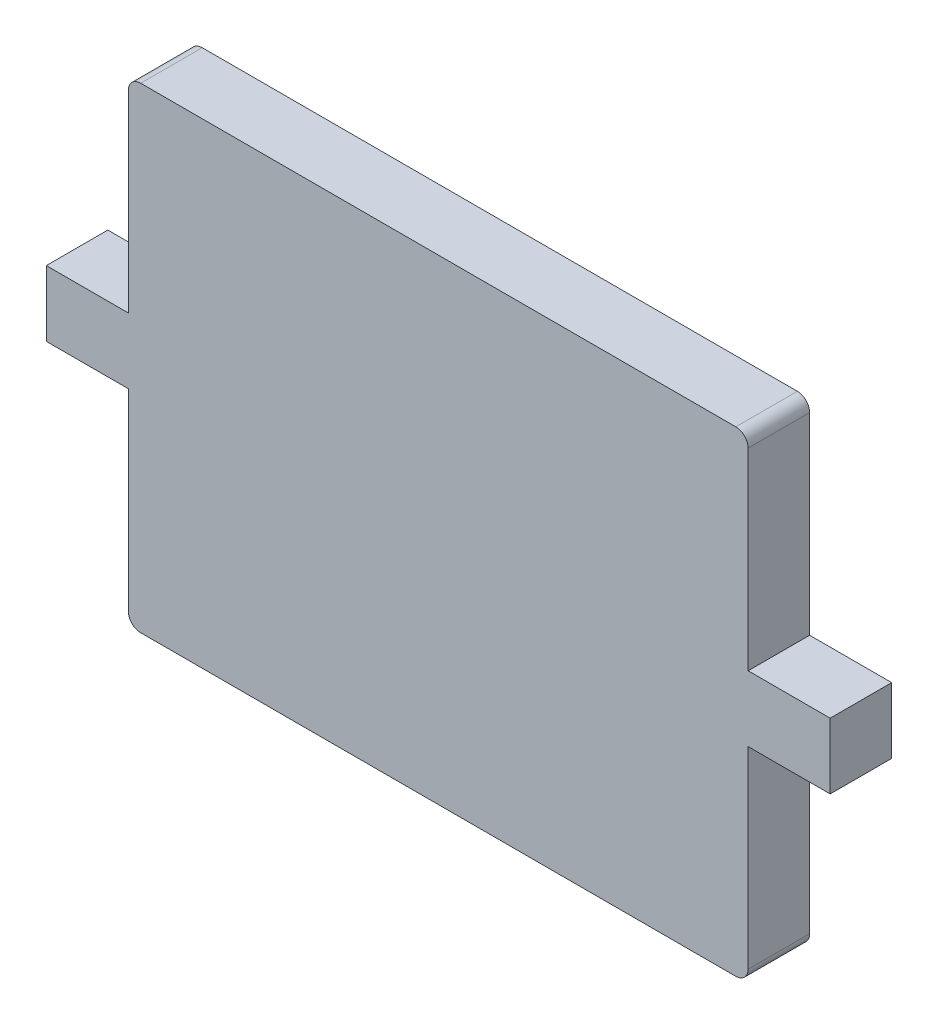
from build123d import *

# Parameters (mm, degrees)
BOSS_EXTRUDE1_DEPTH = 1.5


with BuildPart() as part:
    # Sketch1 → Boss-Extrude1 (new body)
    with BuildSketch(Plane.XY):
        with BuildLine():
            Line((10.518968464, -1.95), (10.518968464, 2.75))
            ThreePointArc((10.518968464, 2.75), (10.431100498, 2.962132034), (10.218968464, 3.05))
            Line((10.218968464, 3.05), (-4.288539585, 3.05))
            ThreePointArc((-4.288539585, 3.05), (-4.50067162, 2.962132034), (-4.588539585, 2.75))
            Line((-4.588539585, 2.75), (-4.588539585, -1.95))
            Line((-4.588539585, -1.95), (-6.588539585, -1.95))
            Line((-6.588539585, -1.95), (-6.588539585, -3.55))
            Line((-6.588539585, -3.55), (-4.588539585, -3.55))
            Line((-4.588539585, -3.55), (-4.588539585, -8.25))
            ThreePointArc((-4.588539585, -8.25), (-4.50067162, -8.462132034), (-4.288539585, -8.55))
            Line((-4.288539585, -8.55), (10.218968464, -8.55))
            ThreePointArc((10.218968464, -8.55), (10.431100498, -8.462132034), (10.518968464, -8.25))
            Line((10.518968464, -8.25), (10.518968464, -3.55))
            Line((10.518968464, -3.55), (12.518968464, -3.55))
            Line((12.518968464, -3.55), (12.518968464, -1.95))
            Line((12.518968464, -1.95), (10.518968464, -1.95))
        make_face()
    extrude(amount=BOSS_EXTRUDE1_DEPTH)


solid = part.part
